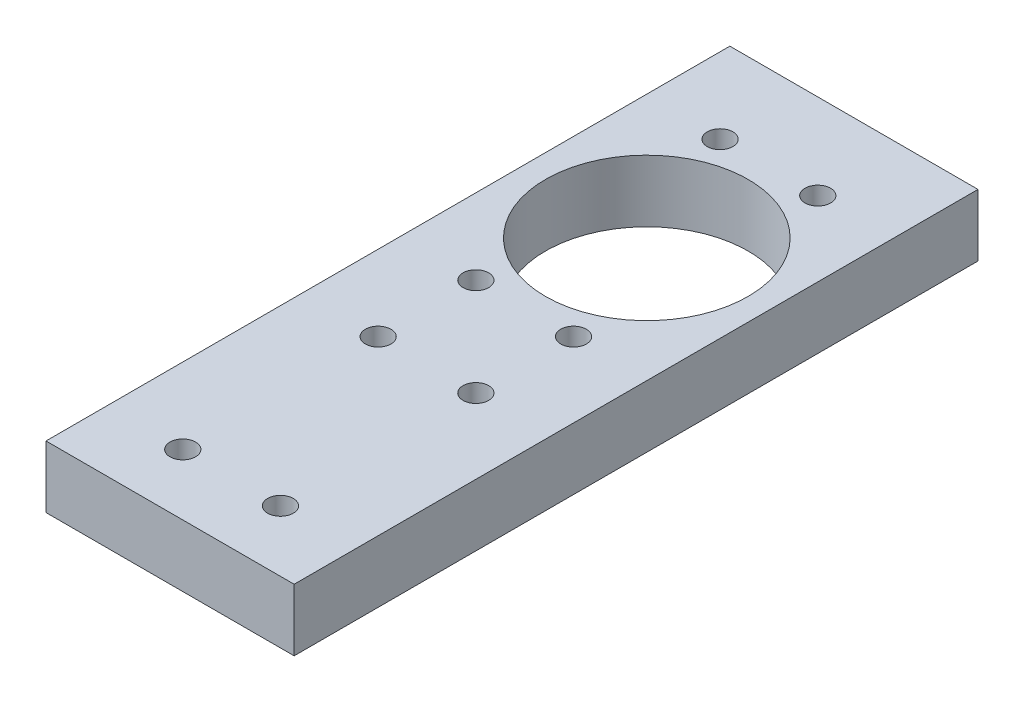
from build123d import *

# Parameters (mm, degrees)
SKETCH2_W           = 101.6
SKETCH2_H           = 280
BOSS_EXTRUDE1_DEPTH = 25.4
SKETCH3_R           = 5.25
SKETCH3_R_2         = 41.5
CUT_EXTRUDE1_DEPTH  = 25.4
SKETCH4_R           = 5.25
CUT_EXTRUDE2_DEPTH  = 25.4


with BuildPart() as part:
    # Sketch2 → Boss-Extrude1 (new body)
    with BuildSketch(Plane(origin=(0, 0, 0), x_dir=(1, 0, 0), z_dir=(0, 1, 0))):
        with Locations((50.8, 140)):
            Rectangle(SKETCH2_W, SKETCH2_H)
    extrude(amount=BOSS_EXTRUDE1_DEPTH)

    # Sketch3 → Cut-Extrude1 (cut)
    with BuildSketch(Plane(origin=(0, 25.4, 0), x_dir=(1, 0, 0), z_dir=(0, 1, 0))):
        with Locations((71, 245)):
            Circle(SKETCH3_R)
        with Locations((31, 245)):
            Circle(SKETCH3_R)
        with Locations((71, 145)):
            Circle(SKETCH3_R)
        with Locations((31, 145)):
            Circle(SKETCH3_R)
        with Locations((51, 195)):
            Circle(SKETCH3_R_2)
    extrude(amount=-CUT_EXTRUDE1_DEPTH, mode=Mode.SUBTRACT)

    # Sketch4 → Cut-Extrude2 (cut)
    with BuildSketch(Plane(origin=(0, 25.4, 0), x_dir=(1, 0, 0), z_dir=(0, 1, 0))):
        with Locations((71, 105)):
            Circle(SKETCH4_R)
        with Locations((31, 105)):
            Circle(SKETCH4_R)
        with Locations((31, 25)):
            Circle(SKETCH4_R)
        with Locations((71, 25)):
            Circle(SKETCH4_R)
    extrude(amount=-CUT_EXTRUDE2_DEPTH, mode=Mode.SUBTRACT)


solid = part.part
